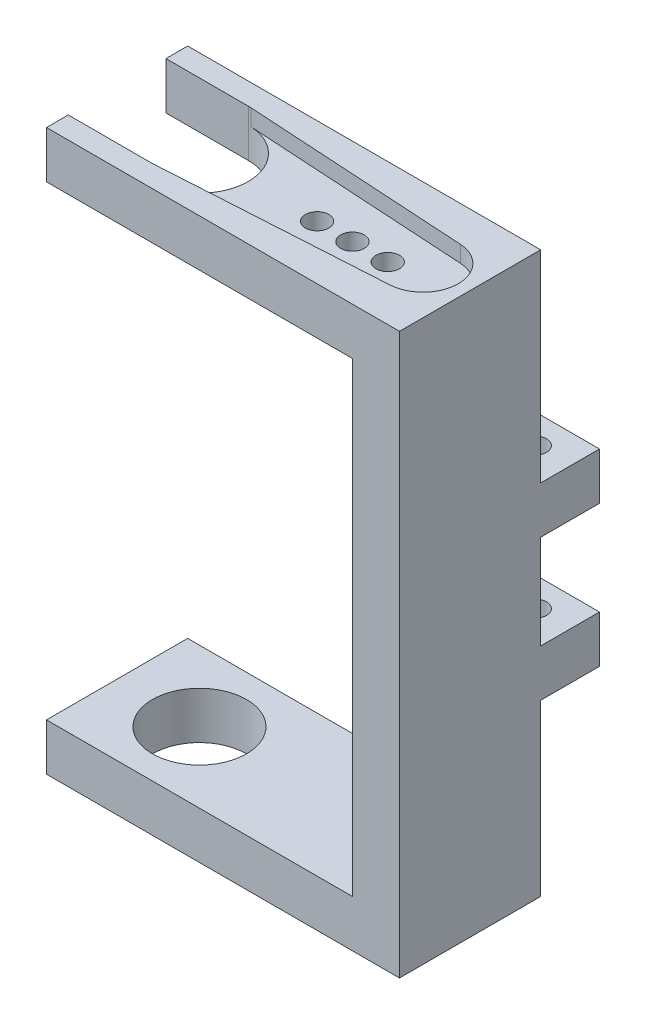
from build123d import *

# Parameters (mm, degrees)
EXTRUDE_1_DEPTH     = 12
SKETCH_2_R          = 4
CUT_EXTRUDE_1_DEPTH = 4
CUT_EXTRUDE_2_DEPTH = 4
SKETCH_4_R          = 1
CUT_EXTRUDE_3_DEPTH = 1.4
CUT_EXTRUDE_4_DEPTH = 4
EXTRUDE_START       = 6
SKETCH_5_W          = 6
SKETCH_5_H          = 5
SKETCH_5_R          = 1
EXTRUDE_2_DEPTH     = 4
EXTRUDE_START_2     = -6
SKETCH_5_2_W        = 6
SKETCH_5_2_H        = 5
SKETCH_5_2_R        = 1
EXTRUDE_3_DEPTH     = 4
FILLET_1_R          = 2


with BuildPart() as part:
    # 草图1 → 凸台-拉伸1 (new body)
    with BuildSketch(Plane.XY):
        Polygon((0, 0), (26, 0), (26, 39.6), (0, 39.6), (0, 43.6), (30, 43.6), (30, -4), (0, -4), align=None)
    extrude(amount=EXTRUDE_1_DEPTH)

    # 草图2 → 切除-拉伸1 (cut)
    with BuildSketch(Plane.XZ.offset(4)):
        with Locations(Location((7, 6, 0), (0, 0, 270))):
            Circle(SKETCH_2_R)
    extrude(amount=-CUT_EXTRUDE_1_DEPTH, mode=Mode.SUBTRACT)

    # 草图3 → 切除-拉伸2 (cut)
    with BuildSketch(Plane(origin=(0, 43.6, 0), x_dir=(1, 0, 0), z_dir=(0, 1, 0))):
        with BuildLine():
            Line((0, -1.85), (0, -10.15))
            Line((0, -10.15), (7, -10.15))
            ThreePointArc((7, -10.15), (11.15, -6), (7, -1.85))
            Line((7, -1.85), (0, -1.85))
        make_face()
    extrude(amount=-CUT_EXTRUDE_2_DEPTH, mode=Mode.SUBTRACT)

    # 草图4 → 切除-拉伸3 (cut)
    with BuildSketch(Plane(origin=(0, 43.6, 0), x_dir=(1, 0, 0), z_dir=(0, 1, 0))):
        with BuildLine():
            ThreePointArc((7.251184211, -1.857608602), (11.15, -6), (7.251184211, -10.142391398))
            Line((7.251184211, -10.142391398), (26.181578947, -8.994499806))
            ThreePointArc((26.181578947, -8.994499806), (29, -6), (26.181578947, -3.005500194))
            Line((26.181578947, -3.005500194), (7.251184211, -1.857608602))
        make_face()
        with Locations(Location((23, -6, 0), (0, 0, 270))):
            Circle(SKETCH_4_R, mode=Mode.SUBTRACT)
        with Locations(Location((20, -6, 0), (0, 0, 270))):
            Circle(SKETCH_4_R, mode=Mode.SUBTRACT)
        with Locations(Location((17, -6, 0), (0, 0, 270))):
            Circle(SKETCH_4_R, mode=Mode.SUBTRACT)
    extrude(amount=-CUT_EXTRUDE_3_DEPTH, mode=Mode.SUBTRACT)

    # 草图4<3> → 切除-拉伸4 (cut)
    with BuildSketch(Plane(origin=(0, 43.6, 0), x_dir=(1, 0, 0), z_dir=(0, 1, 0))):
        with BuildLine():
            ThreePointArc((23, -6), (23.041960108, -6.5), (23.166666667, -6.986013297))
            ThreePointArc((23.166666667, -6.986013297), (23.763762616, -6.645497224), (24, -6))
            Line((24, -6), (23, -6))
        make_face()
        with BuildLine():
            ThreePointArc((22, -6), (22.354502776, -6.763762616), (23.166666667, -6.986013297))
            ThreePointArc((23.166666667, -6.986013297), (23.041960108, -6.5), (23, -6))
            Line((23, -6), (22, -6))
        make_face()
        with BuildLine():
            ThreePointArc((23, -6), (23.041960108, -5.5), (23.166666667, -5.013986703))
            ThreePointArc((23.166666667, -5.013986703), (22.354502776, -5.236237384), (22, -6))
            Line((22, -6), (23, -6))
        make_face()
        with BuildLine():
            ThreePointArc((24, -6), (23.763762616, -5.354502776), (23.166666667, -5.013986703))
            ThreePointArc((23.166666667, -5.013986703), (23.041960108, -5.5), (23, -6))
            Line((23, -6), (24, -6))
        make_face()
        with BuildLine():
            ThreePointArc((21, -6), (20, -5), (19, -6))
            Line((19, -6), (21, -6))
        make_face()
        with BuildLine():
            Line((21, -6), (19, -6))
            ThreePointArc((19, -6), (20, -7), (21, -6))
        make_face()
        with BuildLine():
            ThreePointArc((18, -6), (17, -5), (16, -6))
            Line((16, -6), (18, -6))
        make_face()
        with BuildLine():
            Line((18, -6), (16, -6))
            ThreePointArc((16, -6), (17, -7), (18, -6))
        make_face()
    extrude(amount=-CUT_EXTRUDE_4_DEPTH, mode=Mode.SUBTRACT)

    # 草图5 → 凸台-拉伸2 (add)
    with BuildSketch(Plane(origin=(0, 16.44, 0), x_dir=(1, 0, 0), z_dir=(0, 1, 0)).offset(EXTRUDE_START)):
        with Locations((27, 2.5)):
            Rectangle(SKETCH_5_W, SKETCH_5_H)
        with Locations(Location((27, 2.5, 0), (0, 0, 270))):
            Circle(SKETCH_5_R, mode=Mode.SUBTRACT)
    extrude(amount=EXTRUDE_2_DEPTH)

    # 草图5<2> → 凸台-拉伸3 (add)
    with BuildSketch(Plane(origin=(0, 16.44, 0), x_dir=(1, 0, 0), z_dir=(0, 1, 0)).offset(EXTRUDE_START_2)):
        with Locations((27, 2.5)):
            Rectangle(SKETCH_5_2_W, SKETCH_5_2_H)
        with Locations(Location((27, 2.5, 0), (0, 0, 270))):
            Circle(SKETCH_5_2_R, mode=Mode.SUBTRACT)
    extrude(amount=EXTRUDE_3_DEPTH)

    # 圆角1
    fillet_1_edges = [part.edges().sort_by_distance(p)[0] for p in [
        (26, 12.44, 0),
        (26, 24.44, 0),
    ]]
    fillet(fillet_1_edges, radius=FILLET_1_R - 0.0001)  # a hair under: the kernel refuses the full size


solid = part.part
